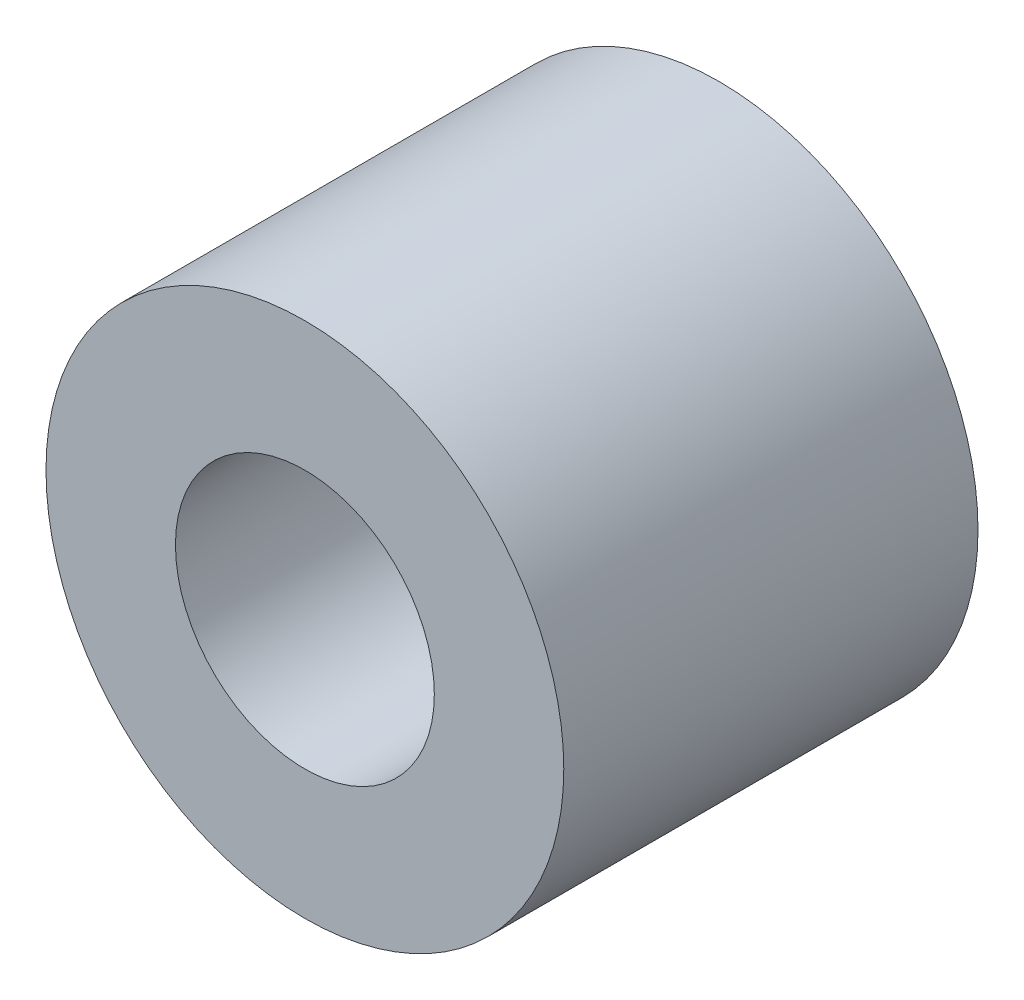
from build123d import *

# Parameters (mm, degrees)
SKETCH1_W = 50.8
SKETCH1_H = 15.875


with BuildPart() as part:
    # Sketch1 → Revolve1 (revolve)
    with BuildSketch(Plane(origin=(0, 0, 0), x_dir=(0, 0, -1), z_dir=(1, 0, 0))):
        with Locations((130.175, 1009.2055)):
            Rectangle(SKETCH1_W, SKETCH1_H)
    revolve(axis=Axis((0, 985.393, 0), (0, 0, -1)))


solid = part.part
